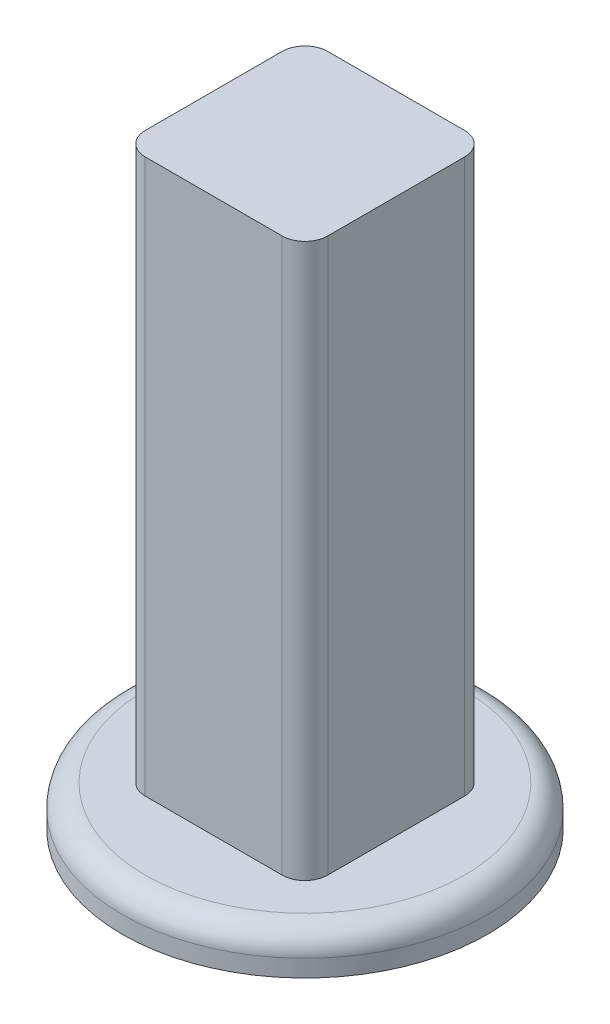
from build123d import *

# Parameters (mm, degrees)
SKETCH1_R           = 8
SKETCH1_W           = 8
SKETCH1_H           = 8
BOSS_EXTRUDE1_DEPTH = 1.75
SKETCH1_2_W         = 8
SKETCH1_2_H         = 8
BOSS_EXTRUDE2_DEPTH = 26
FILLET1_R           = 1


with BuildPart() as part:
    # Sketch1 → Boss-Extrude1 (new body)
    with BuildSketch(Plane(origin=(0, 0, 0), x_dir=(1, 0, 0), z_dir=(0, 1, 0))):
        Circle(SKETCH1_R)
        Rectangle(SKETCH1_W, SKETCH1_H, mode=Mode.SUBTRACT)
    extrude(amount=BOSS_EXTRUDE1_DEPTH)

    # Sketch1<2> → Boss-Extrude2 (add)
    with BuildSketch(Plane(origin=(0, 0, 0), x_dir=(1, 0, 0), z_dir=(0, 1, 0))):
        Rectangle(SKETCH1_2_W, SKETCH1_2_H)
    extrude(amount=BOSS_EXTRUDE2_DEPTH)

    # Fillet1
    fillet1_edges = [part.edges().sort_by_distance(p)[0] for p in [
        (-4, 13.875, 4),
        (4, 13.875, 4),
        (4, 13.875, -4),
        (-4, 13.875, -4),
        (-8, 1.75, 0),
    ]]
    fillet(fillet1_edges, radius=FILLET1_R)


solid = part.part
